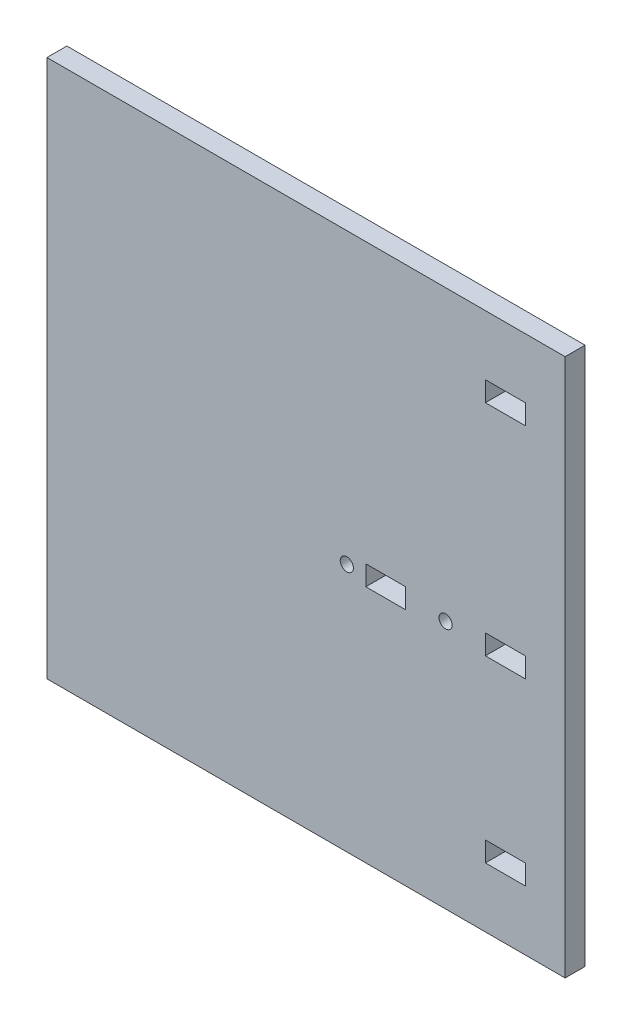
from build123d import *

# Parameters (mm, degrees)
SKETCH1_W           = 165.1
SKETCH1_H           = 171.45
BOSS_EXTRUDE1_DEPTH = 6.35
SKETCH2_R           = 2.0955
SKETCH2_W           = 12.7
SKETCH2_H           = 6.35
CUT_EXTRUDE1_DEPTH  = 223.363363945
SKETCH3_W           = 12.7
SKETCH3_H           = 6.35
CUT_EXTRUDE2_DEPTH  = 223.363363945


with BuildPart() as part:
    # Sketch1 → Boss-Extrude1 (new body)
    with BuildSketch(Plane.XY):
        with Locations((76.2, 69.85)):
            Rectangle(SKETCH1_W, SKETCH1_H)
    extrude(amount=BOSS_EXTRUDE1_DEPTH)

    # Sketch2 → Cut-Extrude1 (cut, through all)
    with BuildSketch(Plane.XY.offset(6.35)):
        with Locations((120.65, 63.5)):
            Circle(SKETCH2_R)
        with Locations((89.190901447, 63.5)):
            Circle(SKETCH2_R)
        with Locations((139.7, 63.5)):
            Rectangle(SKETCH2_W, SKETCH2_H)
        with Locations((101.6, 63.5)):
            Rectangle(SKETCH2_W, SKETCH2_H)
    extrude(amount=-CUT_EXTRUDE1_DEPTH, mode=Mode.SUBTRACT)

    # Sketch3 → Cut-Extrude2 (cut, through all)
    with BuildSketch(Plane.XY.offset(6.35)):
        with Locations((139.7, 6.35)):
            Rectangle(SKETCH3_W, SKETCH3_H)
        with Locations((139.7, 133.35)):
            Rectangle(SKETCH3_W, SKETCH3_H)
    extrude(amount=-CUT_EXTRUDE2_DEPTH, mode=Mode.SUBTRACT)


solid = part.part
